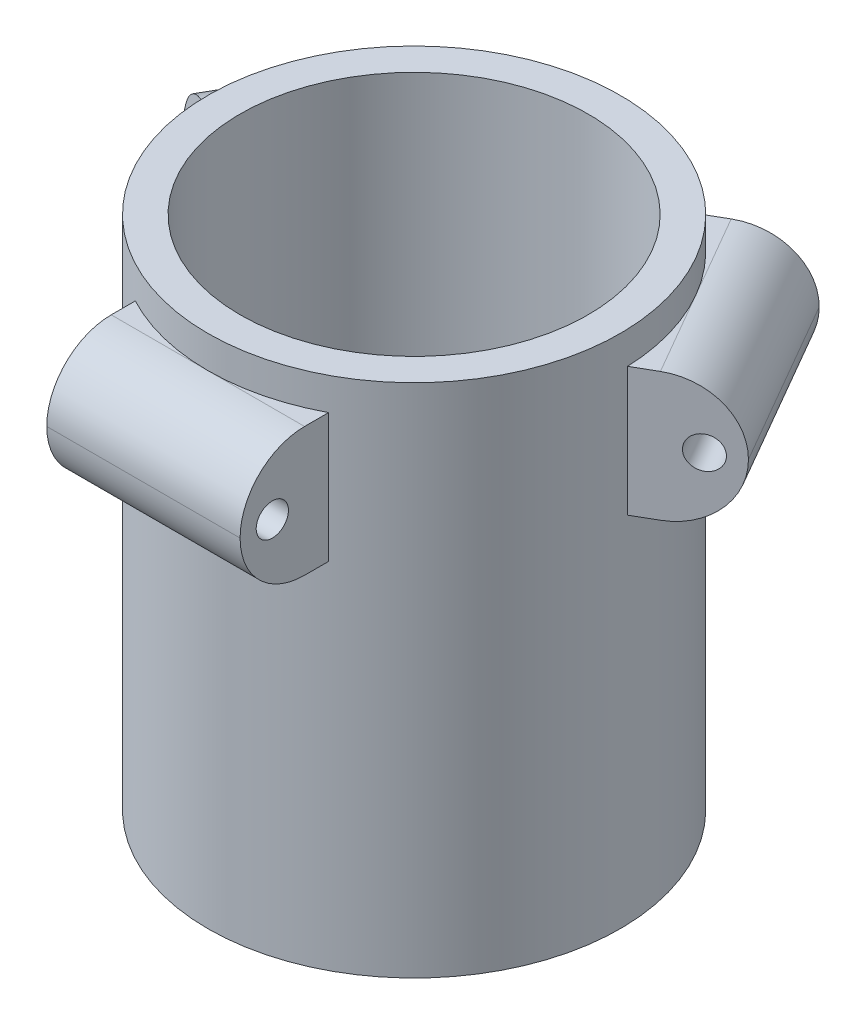
from build123d import *

# Parameters (mm, degrees)
SKETCH1_R                = 20.32
BOSS_EXTRUDE1_DEPTH      = 50.8
SHELL1_T                 = -3.175
CUT_EXTRUDE1_DEPTH       = 56.623245366
CUT_EXTRUDE1_DEPTH_BACK  = 46.482
SKETCH2_R                = 4.064
BOSS_EXTRUDE2_START      = -34.925
BOSS_EXTRUDE2_DEPTH      = 12.7
SKETCH4_R                = 1.5875
CUT_EXTRUDE2_DEPTH       = 19.05
FILLET1_R                = 6.35
CIRPATTERN1_COUNT        = 3
FILLET1_OF_CIRPATTERN1_R = 6.35


with BuildPart() as part:
    # Sketch1 → Boss-Extrude1 (new body)
    with BuildSketch(Plane(origin=(0, 0, 0), x_dir=(1, 0, 0), z_dir=(0, 1, 0))):
        with Locations(Location((0, 0, 0), (0, 0, 270))):
            Circle(SKETCH1_R)
    extrude(amount=BOSS_EXTRUDE1_DEPTH)

    # Shell1
    shell1_openings = [part.faces().sort_by_distance(p)[0] for p in [
        (0, 50.8, 0),
    ]]
    offset(amount=SHELL1_T, openings=shell1_openings, kind=Kind.INTERSECTION)

    # Sketch2 → Cut-Extrude1 (cut, two sides: drawn at the far end of the back side and taken through both)
    with BuildSketch(Plane(origin=(0, 3.175, 0), x_dir=(1, 0, 0), z_dir=(0, 1, 0)).offset(-CUT_EXTRUDE1_DEPTH_BACK)):
        with Locations(Location((0, 0, 0), (0, 0, 270))):
            Circle(SKETCH2_R)
    extrude(amount=CUT_EXTRUDE1_DEPTH + CUT_EXTRUDE1_DEPTH_BACK, mode=Mode.SUBTRACT)

    # Sketch3 → Boss-Extrude2 (add)
    with BuildSketch(Plane.XZ.offset(BOSS_EXTRUDE2_START)):
        with BuildLine():
            ThreePointArc((-9.525, 17.949283412), (0, 20.32), (9.525, 17.949283412))
            Line((9.525, 17.949283412), (9.525, 26.67))
            Line((9.525, 26.67), (-9.525, 26.67))
            Line((-9.525, 26.67), (-9.525, 17.949283412))
        make_face()
    boss_extrude2 = extrude(amount=-BOSS_EXTRUDE2_DEPTH)

    # Sketch4 → Cut-Extrude2 (cut)
    with BuildSketch(Plane(origin=(9.525, 0, 0), x_dir=(0, 0, -1), z_dir=(1, 0, 0))):
        with Locations((-23.495, 41.275)):
            Circle(SKETCH4_R)
    cut_extrude2 = extrude(amount=-CUT_EXTRUDE2_DEPTH, mode=Mode.SUBTRACT)

    # Fillet1
    fillet1_edges = [part.edges().sort_by_distance(p)[0] for p in [
        (0, 47.625, 26.67),
        (0, 34.925, 26.67),
    ]]
    fillet(fillet1_edges, radius=FILLET1_R - 0.0001)  # a hair under: the kernel refuses the full size

    # CirPattern1: Boss-Extrude2, Cut-Extrude2 ×3 about axis
    cirpattern1_axis = Axis((0, 0, 0), (0, 1, 0))
    add([boss_extrude2.rotate(cirpattern1_axis, i * 360 / CIRPATTERN1_COUNT) for i in range(1, CIRPATTERN1_COUNT)])
    add([cut_extrude2.rotate(cirpattern1_axis, i * 360 / CIRPATTERN1_COUNT) for i in range(1, CIRPATTERN1_COUNT)], mode=Mode.SUBTRACT)

    # Fillet1 of CirPattern1
    fillet1_of_cirpattern1_edges = [part.edges().sort_by_distance(p)[0] for p in [
        (23.096897519, 47.625, -13.335),
        (23.096897519, 34.925, -13.335),
        (-23.096897519, 47.625, -13.335),
        (-23.096897519, 34.925, -13.335),
    ]]
    fillet(fillet1_of_cirpattern1_edges, radius=FILLET1_OF_CIRPATTERN1_R - 0.0001)  # a hair under: the kernel refuses the full size


solid = part.part
